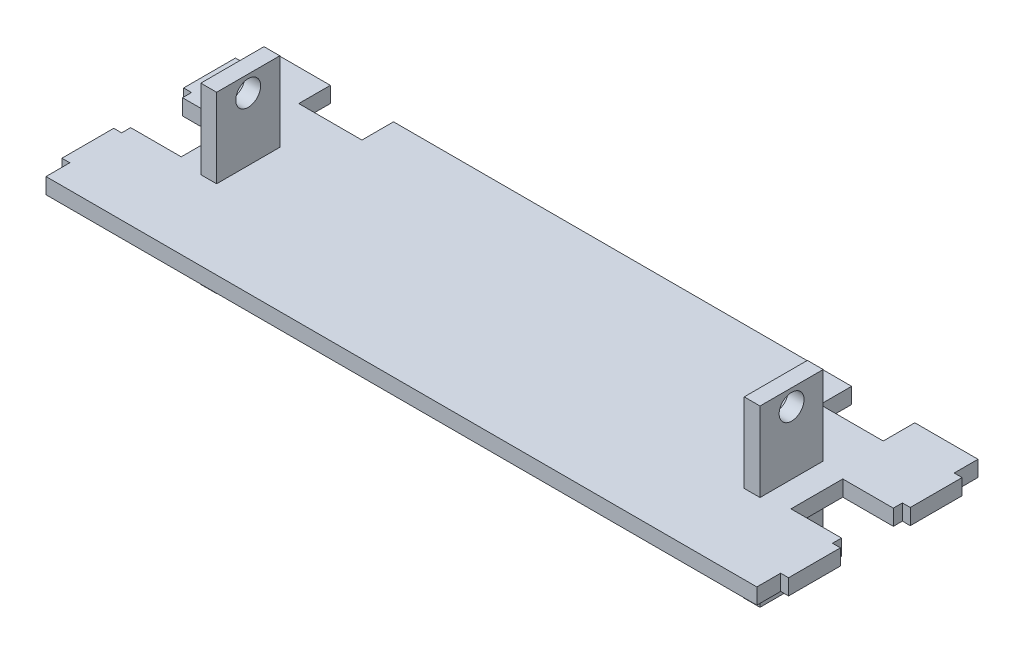
from build123d import *

# Parameters (mm, degrees)
BOSS_EXTRUDE1_DEPTH     = 3.175
SKETCH2_W               = 6.35
SKETCH2_H               = 25.4
BOSS_EXTRUDE2_DEPTH     = 35.052
CUT_EXTRUDE1_DEPTH      = 265.571848897
CUT_EXTRUDE1_DEPTH_BACK = 265.571848897
SKETCH5_R               = 5.0038


with BuildPart() as part:
    # Sketch1 → Boss-Extrude1 (new, symmetric)
    with BuildSketch(Plane(origin=(0, 0, 0), x_dir=(1, 0, 0), z_dir=(0, 1, 0))):
        Polygon((142.875, -44.45), (-142.875, -44.45), (-142.875, -34.874677354), (-146.05, -34.874677354), (-146.05, -14.046677354), (-142.875, -14.046677354), (-142.875, -10.414), (-122.555, -10.414), (-122.555, 10.414), (-142.875, 10.414), (-142.875, 14.046677354), (-146.05, 14.046677354), (-146.05, 34.874677354), (-142.875, 34.874677354), (-142.875, 44.45), (-117.475, 44.45), (-117.475, 31.75), (-92.075, 31.75), (-92.075, 44.45), (92.075, 44.45), (92.075, 31.75), (117.475, 31.75), (117.475, 44.45), (142.875, 44.45), (142.875, 34.874677354), (146.05, 34.874677354), (146.05, 14.046677354), (142.875, 14.046677354), (142.875, 10.414), (122.555, 10.414), (122.555, -10.414), (142.875, -10.414), (142.875, -14.046677354), (146.05, -14.046677354), (146.05, -34.874677354), (142.875, -34.874677354), align=None)
    extrude(amount=BOSS_EXTRUDE1_DEPTH, both=True)

    # Sketch2 → Boss-Extrude2 (add, symmetric)
    with BuildSketch(Plane(origin=(0, 0, 0), x_dir=(1, 0, 0), z_dir=(0, 1, 0))):
        with Locations((109.22, 0)):
            Rectangle(SKETCH2_W, SKETCH2_H)
        with Locations((-109.22, 0)):
            Rectangle(SKETCH2_W, SKETCH2_H)
    extrude(amount=BOSS_EXTRUDE2_DEPTH, both=True)

    # Sketch5 → Cut-Extrude1 (cut, two sides: drawn at the far end of the back side and taken through both)
    with BuildSketch(Plane.ZY.offset(112.395).offset(-CUT_EXTRUDE1_DEPTH_BACK)):
        with Locations((0, 28.448)):
            Circle(SKETCH5_R)
        with Locations((0, -28.448)):
            Circle(SKETCH5_R)
    extrude(amount=CUT_EXTRUDE1_DEPTH + CUT_EXTRUDE1_DEPTH_BACK, mode=Mode.SUBTRACT)


solid = part.part
